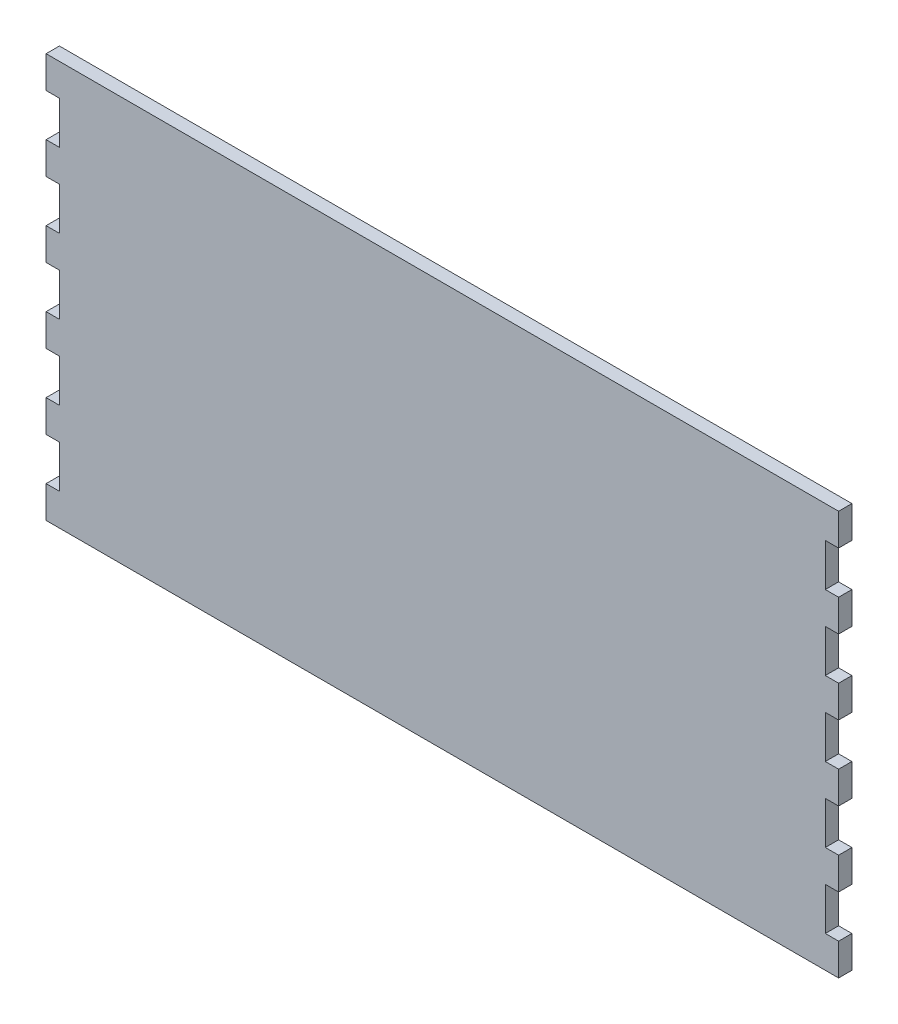
from build123d import *

# Parameters (mm, degrees)
SKETCH1_W               = 189.23
SKETCH1_H               = 96.52
BOSS_EXTRUDE1_DEPTH     = 3.175
SKETCH2_W               = 3.175
SKETCH2_H               = 10.16
CUT_EXTRUDE1_DEPTH      = 117.461826897
LPATTERN1_COUNT         = 5
LPATTERN1_PITCH         = 17.78
MIRROR1_COPY_1_SKETCH_W = 3.175
MIRROR1_COPY_1_SKETCH_H = 10.16
MIRROR1_COPY_1_DEPTH    = 117.461826897
MIRROR1_COPY_2_SKETCH_W = 3.175
MIRROR1_COPY_2_SKETCH_H = 10.16
MIRROR1_COPY_2_DEPTH    = 117.461826897
MIRROR1_COPY_3_SKETCH_W = 3.175
MIRROR1_COPY_3_SKETCH_H = 10.16
MIRROR1_COPY_3_DEPTH    = 117.461826897
MIRROR1_COPY_4_SKETCH_W = 3.175
MIRROR1_COPY_4_SKETCH_H = 10.16
MIRROR1_COPY_4_DEPTH    = 117.461826897
MIRROR1_COPY_5_SKETCH_W = 3.175
MIRROR1_COPY_5_SKETCH_H = 10.16
MIRROR1_COPY_5_DEPTH    = 117.461826897


with BuildPart() as part:
    # Sketch1 → Boss-Extrude1 (new body)
    with BuildSketch(Plane.XY):
        with Locations((11.174813084, -0.338271028)):
            Rectangle(SKETCH1_W, SKETCH1_H)
    extrude(amount=BOSS_EXTRUDE1_DEPTH)

    # Sketch2 → Cut-Extrude1 (cut, through all)
    with BuildSketch(Plane.XY.offset(3.175)):
        with Locations((-81.852686916, 35.221728972)):
            Rectangle(SKETCH2_W, SKETCH2_H)
    cut_extrude1 = extrude(amount=-CUT_EXTRUDE1_DEPTH, mode=Mode.SUBTRACT)

    # LPattern1: Cut-Extrude1 ×5
    with Locations(*[(0, -i * LPATTERN1_PITCH, 0) for i in range(1, LPATTERN1_COUNT)]):
        add(cut_extrude1, mode=Mode.SUBTRACT)

    # Mirror1 copy 1 sketch → Mirror1 copy 1 (cut, through all)
    with BuildSketch(Plane(origin=(22.349626168, -17.78, 3.175), x_dir=(-1, 0, 0), z_dir=(0, 0, 1))):
        with Locations((-81.852686916, -35.221728972)):
            Rectangle(MIRROR1_COPY_1_SKETCH_W, MIRROR1_COPY_1_SKETCH_H)
    extrude(amount=-MIRROR1_COPY_1_DEPTH, mode=Mode.SUBTRACT)

    # Mirror1 copy 2 sketch → Mirror1 copy 2 (cut, through all)
    with BuildSketch(Plane(origin=(22.349626168, -35.56, 3.175), x_dir=(-1, 0, 0), z_dir=(0, 0, 1))):
        with Locations((-81.852686916, -35.221728972)):
            Rectangle(MIRROR1_COPY_2_SKETCH_W, MIRROR1_COPY_2_SKETCH_H)
    extrude(amount=-MIRROR1_COPY_2_DEPTH, mode=Mode.SUBTRACT)

    # Mirror1 copy 3 sketch → Mirror1 copy 3 (cut, through all)
    with BuildSketch(Plane(origin=(22.349626168, -53.34, 3.175), x_dir=(-1, 0, 0), z_dir=(0, 0, 1))):
        with Locations((-81.852686916, -35.221728972)):
            Rectangle(MIRROR1_COPY_3_SKETCH_W, MIRROR1_COPY_3_SKETCH_H)
    extrude(amount=-MIRROR1_COPY_3_DEPTH, mode=Mode.SUBTRACT)

    # Mirror1 copy 4 sketch → Mirror1 copy 4 (cut, through all)
    with BuildSketch(Plane(origin=(22.349626168, -71.12, 3.175), x_dir=(-1, 0, 0), z_dir=(0, 0, 1))):
        with Locations((-81.852686916, -35.221728972)):
            Rectangle(MIRROR1_COPY_4_SKETCH_W, MIRROR1_COPY_4_SKETCH_H)
    extrude(amount=-MIRROR1_COPY_4_DEPTH, mode=Mode.SUBTRACT)

    # Mirror1 copy 5 sketch → Mirror1 copy 5 (cut, through all)
    with BuildSketch(Plane(origin=(22.349626168, 0, 3.175), x_dir=(-1, 0, 0), z_dir=(0, 0, 1))):
        with Locations((-81.852686916, -35.221728972)):
            Rectangle(MIRROR1_COPY_5_SKETCH_W, MIRROR1_COPY_5_SKETCH_H)
    extrude(amount=-MIRROR1_COPY_5_DEPTH, mode=Mode.SUBTRACT)


solid = part.part
